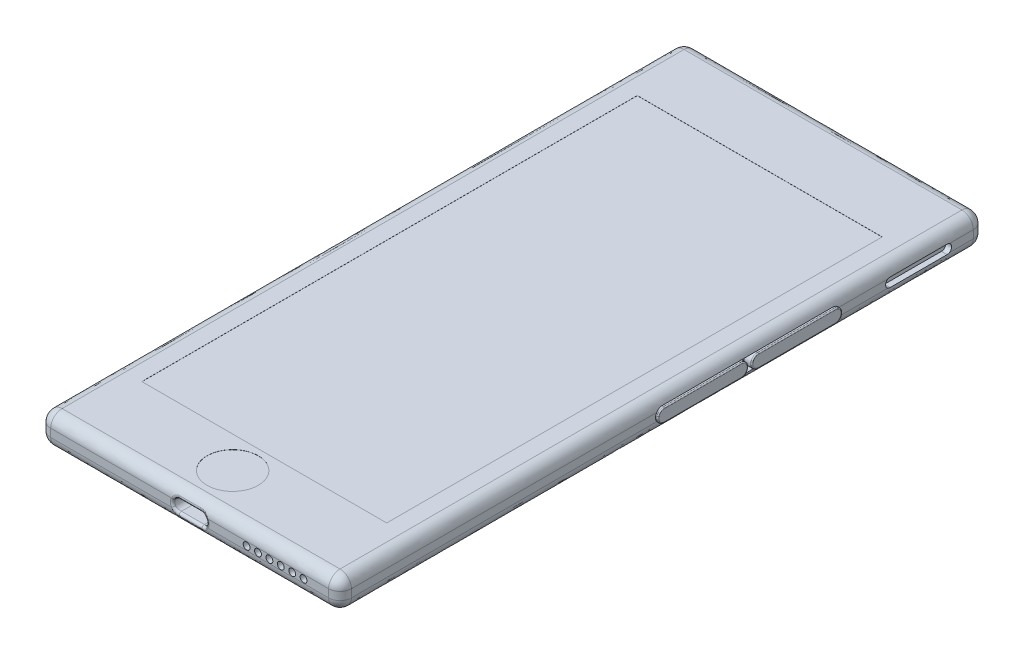
from build123d import *

# Parameters (mm, degrees)
SKETCH2_W           = 67.056
SKETCH2_H           = 143.764
BOSS_EXTRUDE1_DEPTH = 6.858
FILLET1_R           = 2.54
SKETCH3_W           = 54.61
SKETCH3_H           = 110.49
CUT_EXTRUDE1_DEPTH  = 0.0254
SKETCH4_R           = 5.715
CUT_EXTRUDE2_DEPTH  = 0.0254
CUT_EXTRUDE3_DEPTH  = 1.27
BOSS_EXTRUDE4_START = 1.778
BOSS_EXTRUDE4_DEPTH = 1.778
FILLET2_R           = 0.254
SKETCH8_R           = 0.762
CUT_EXTRUDE5_DEPTH  = 1.778
LPATTERN1_COUNT     = 6
LPATTERN1_PITCH     = 2.54
CUT_EXTRUDE6_DEPTH  = 3.81
FILLET3_R           = 0.508


with BuildPart() as part:
    # Sketch2 → Boss-Extrude1 (new body)
    with BuildSketch(Plane(origin=(0, 0, 0), x_dir=(1, 0, 0), z_dir=(0, 1, 0))):
        Rectangle(SKETCH2_W, SKETCH2_H)
    extrude(amount=BOSS_EXTRUDE1_DEPTH)

    # Fillet1
    fillet1_edges = [part.edges().sort_by_distance(p)[0] for p in [
        (33.528, 0, 0),
        (0, 0, 71.882),
        (-33.528, 0, 0),
        (0, 0, -71.882),
        (-33.528, 3.429, -71.882),
        (33.528, 3.429, 71.882),
        (33.528, 3.429, -71.882),
        (-33.528, 3.429, 71.882),
        (0, 6.858, -71.882),
        (33.528, 6.858, 0),
        (0, 6.858, 71.882),
        (-33.528, 6.858, 0),
    ]]
    fillet(fillet1_edges, radius=FILLET1_R)

    # Sketch3 → Cut-Extrude1 (cut)
    with BuildSketch(Plane(origin=(0, 6.858, 0), x_dir=(1, 0, 0), z_dir=(0, 1, 0))):
        Rectangle(SKETCH3_W, SKETCH3_H)
    extrude(amount=-CUT_EXTRUDE1_DEPTH, mode=Mode.SUBTRACT)

    # Sketch4 → Cut-Extrude2 (cut)
    with BuildSketch(Plane(origin=(0, 6.858, 0), x_dir=(1, 0, 0), z_dir=(0, 1, 0))):
        with Locations((0, -62.2935)):
            Circle(SKETCH4_R)
    extrude(amount=-CUT_EXTRUDE2_DEPTH, mode=Mode.SUBTRACT)

    # Sketch5 → Cut-Extrude3 (cut)
    with BuildSketch(Plane(origin=(33.528, 0, 0), x_dir=(0, 0, -1), z_dir=(1, 0, 0))):
        with BuildLine():
            Line((0, 4.953), (38.1, 4.953))
            ThreePointArc((38.1, 4.953), (39.624, 3.429), (38.1, 1.905))
            Line((38.1, 1.905), (0, 1.905))
            ThreePointArc((0, 1.905), (-1.524, 3.429), (0, 4.953))
        make_face()
        with BuildLine():
            Line((50.8, 4.445), (63.5, 4.445))
            ThreePointArc((63.5, 4.445), (64.516, 3.429), (63.5, 2.413))
            Line((63.5, 2.413), (50.8, 2.413))
            ThreePointArc((50.8, 2.413), (49.784, 3.429), (50.8, 4.445))
        make_face()
    extrude(amount=-CUT_EXTRUDE3_DEPTH, mode=Mode.SUBTRACT)

    # Sketch6 → Boss-Extrude4 (add)
    with BuildSketch(Plane(origin=(32.258, 0, 0), x_dir=(0, 0, -1), z_dir=(1, 0, 0)).offset(BOSS_EXTRUDE4_START)):
        with BuildLine():
            Line((0, 4.953), (17.145, 4.953))
            ThreePointArc((17.145, 4.953), (18.669, 3.429), (17.145, 1.905))
            Line((17.145, 1.905), (0, 1.905))
            ThreePointArc((0, 1.905), (-1.524, 3.429), (0, 4.953))
        make_face()
        with BuildLine():
            Line((38.1, 1.905), (20.955, 1.905))
            ThreePointArc((20.955, 1.905), (19.431, 3.429), (20.955, 4.953))
            Line((20.955, 4.953), (38.1, 4.953))
            ThreePointArc((38.1, 4.953), (39.624, 3.429), (38.1, 1.905))
        make_face()
    extrude(amount=-BOSS_EXTRUDE4_DEPTH)

    # Fillet2
    fillet2_edges = [part.edges().sort_by_distance(p)[0] for p in [
        (34.036, 4.953, -29.5275),
        (34.036, 3.429, -39.624),
        (34.036, 1.905, -29.5275),
        (34.036, 3.429, -19.431),
        (34.036, 3.429, -18.669),
        (34.036, 4.953, -8.5725),
        (34.036, 3.429, 1.524),
        (34.036, 1.905, -8.5725),
    ]]
    fillet(fillet2_edges, radius=FILLET2_R)

    # Sketch8 → Cut-Extrude5 (cut)
    with BuildSketch(Plane.XY.offset(71.882)):
        with Locations((12.7, 3.429)):
            Circle(SKETCH8_R)
    cut_extrude5 = extrude(amount=-CUT_EXTRUDE5_DEPTH, mode=Mode.SUBTRACT)

    # LPattern1: Cut-Extrude5 ×6
    with Locations(*[(i * LPATTERN1_PITCH, 0, 0) for i in range(1, LPATTERN1_COUNT)]):
        add(cut_extrude5, mode=Mode.SUBTRACT)

    # Sketch9 → Cut-Extrude6 (cut)
    with BuildSketch(Plane.XY.offset(71.882)):
        with BuildLine():
            Line((-2.54, 4.699), (2.54, 4.699))
            ThreePointArc((2.54, 4.699), (3.81, 3.429), (2.54, 2.159))
            Line((2.54, 2.159), (-2.54, 2.159))
            ThreePointArc((-2.54, 2.159), (-3.81, 3.429), (-2.54, 4.699))
        make_face()
    extrude(amount=-CUT_EXTRUDE6_DEPTH, mode=Mode.SUBTRACT)

    # Fillet3
    fillet3_edges = [part.edges().sort_by_distance(p)[0] for p in [
        (3.031903445, 4.599867634, 71.866311919),
        (3.81, 3.429, 71.882),
        (3.031903445, 2.258132366, 71.866311919),
        (0, 2.159, 71.853262432),
        (-3.031903445, 2.258132366, 71.866311919),
        (-3.81, 3.429, 71.882),
        (-3.031903445, 4.599867634, 71.866311919),
        (0, 4.699, 71.853262432),
    ]]
    fillet(fillet3_edges, radius=FILLET3_R)


solid = part.part
